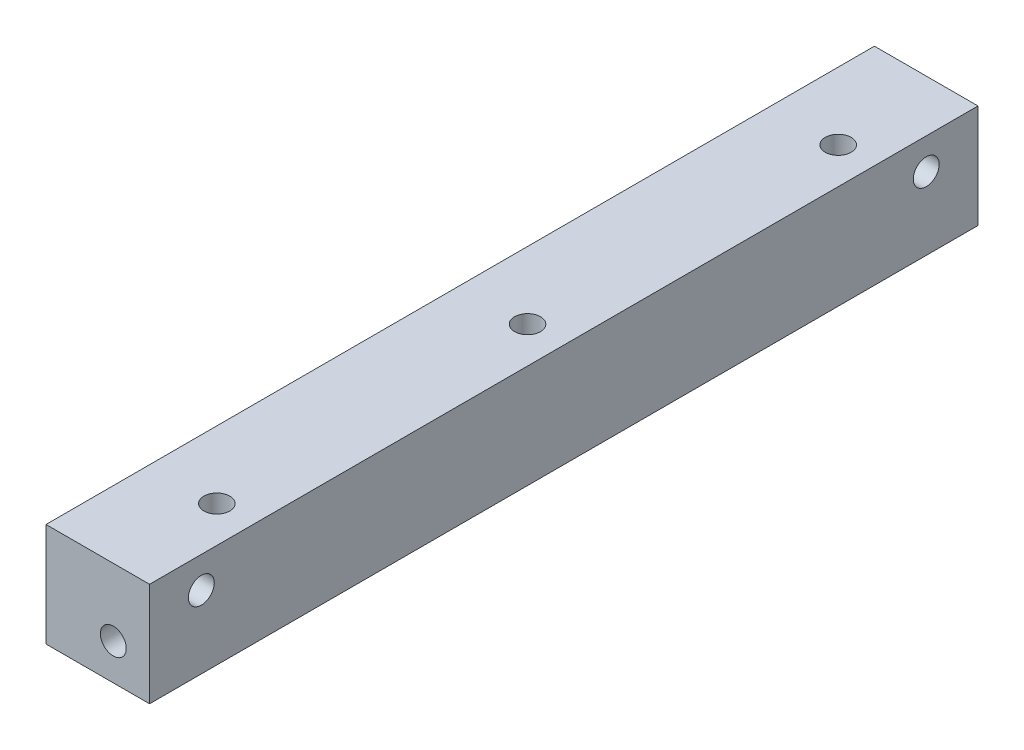
from build123d import *

# Parameters (mm, degrees)
IZIM1_W                          = 20
IZIM1_H                          = 20
Y_KSEKLIK_EKSTR_ZYON1_DEPTH      = 160
F_4_0MM_SAPLAMA_DELIKLERI3_D     = 5
F_4_0MM_SAPLAMA_DELIKLERI3_DEPTH = 10
F_4_0MM_SAPLAMA_DELIKLERI4_D     = 5
F_4_0MM_SAPLAMA_DELIKLERI4_DEPTH = 10
IZIM13_R                         = 2.5
KES_EKSTR_ZYON1_DEPTH            = 10
KES_EKSTR_ZYON2_START            = -10
IZIM15_R                         = 2.5
KES_EKSTR_ZYON2_DEPTH            = 10
IZIM18_R                         = 2.5
KES_EKSTR_ZYON3_DEPTH            = 10
IZIM20_R                         = 2.5
KES_EKSTR_ZYON4_DEPTH            = 10


with BuildPart() as part:
    # Çizim1 → Yükseklik-Ekstrüzyon1 (new body)
    with BuildSketch(Plane.XY):
        with Locations((10, 10)):
            Rectangle(IZIM1_W, IZIM1_H)
    extrude(amount=Y_KSEKLIK_EKSTR_ZYON1_DEPTH)

    # Ø4.0mm Saplama Delikleri3
    with Locations(Plane(origin=(0, 7, 20), x_dir=(0, 0, -1), z_dir=(-1, 0, 0))):
        with Locations((0, 0), (-60, 0), (-120, 0)):
            Hole(F_4_0MM_SAPLAMA_DELIKLERI3_D / 2, depth=F_4_0MM_SAPLAMA_DELIKLERI3_DEPTH)

    # Ø4.0mm Saplama Delikleri4
    with Locations(Plane(origin=(13, 20, 20), x_dir=(0, 0, 1), z_dir=(0, 1, 0))):
        with Locations((0, 0), (60, 0), (120, 0)):
            Hole(F_4_0MM_SAPLAMA_DELIKLERI4_D / 2, depth=F_4_0MM_SAPLAMA_DELIKLERI4_DEPTH)

    # Çizim13 → Kes-Ekstrüzyon1 (cut)
    with BuildSketch(Plane.XY.offset(160)):
        with Locations((13, 7)):
            Circle(IZIM13_R)
    extrude(amount=-KES_EKSTR_ZYON1_DEPTH, mode=Mode.SUBTRACT)

    # Çizim15 → Kes-Ekstrüzyon2 (cut)
    with BuildSketch(Plane(origin=(0, 0, 0), x_dir=(-1, 0, 0), z_dir=(0, 0, -1)).offset(KES_EKSTR_ZYON2_START)):
        with Locations((-13, 7)):
            Circle(IZIM15_R)
    extrude(amount=KES_EKSTR_ZYON2_DEPTH, mode=Mode.SUBTRACT)

    # Çizim18 → Kes-Ekstrüzyon3 (cut)
    with BuildSketch(Plane(origin=(20, 0, 0), x_dir=(0, 0, -1), z_dir=(1, 0, 0))):
        with Locations((-10, 14)):
            Circle(IZIM18_R)
        with Locations((-150, 14)):
            Circle(IZIM18_R)
    extrude(amount=-KES_EKSTR_ZYON3_DEPTH, mode=Mode.SUBTRACT)

    # Çizim20 → Kes-Ekstrüzyon4 (cut)
    with BuildSketch(Plane.XZ):
        with Locations((6, 10)):
            Circle(IZIM20_R)
        with Locations((6, 150)):
            Circle(IZIM20_R)
    extrude(amount=-KES_EKSTR_ZYON4_DEPTH, mode=Mode.SUBTRACT)


solid = part.part
